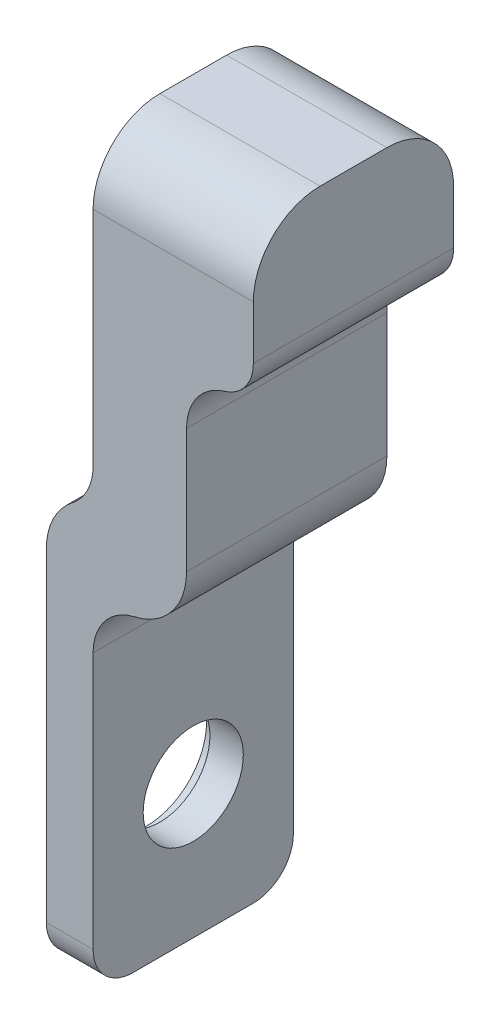
from build123d import *

# Parameters (mm, degrees)
BOSS_EXTRUDE1_DEPTH      = 12.5
BOSS_EXTRUDE1_DEPTH_BACK = 2.5
F_3DSKETCH2_R            = 4.5
CUT_EXTRUDE2_DEPTH       = 1
CUT_EXTRUDE3_REACH       = 68.802
SKETCH3_R                = 3.75
CUT_EXTRUDE6_OUTLINE_R   = 3.25
CUT_EXTRUDE6_DEPTH       = 10
CUT_EXTRUDE7_DEPTH       = 2.5
FILLET1_R                = 5
FILLET2_R                = 4
FILLET3_R                = 4
FILLET4_R                = 3
FILLET5_R                = 3
FILLET6_R                = 4


# Read off the part's stored shape, not the designer's step: Cut-Extrude6
with BuildPart() as part:
    # Sketch1 → Boss-Extrude1 (new, two sides: drawn at the far end of the back side and taken through both)
    with BuildSketch(Plane.XY.offset(-BOSS_EXTRUDE1_DEPTH_BACK)):
        Polygon((0, -8), (0, -32), (-3.5, -32), (-3.5, -64), (0, -64), (0, -38), (7, -38), (7, -20), (12, -20), (12, -8), align=None)
    extrude(amount=BOSS_EXTRUDE1_DEPTH + BOSS_EXTRUDE1_DEPTH_BACK)

    # 3DSketch2 → Cut-Extrude2 (cut)
    with BuildSketch(Plane(origin=(-3.5, -54, 5), x_dir=(0, -1, 0), z_dir=(-1, 0, 0))):
        with Locations(Location((0, 0, 0), (0, 0, 270))):
            Circle(F_3DSKETCH2_R)
    extrude(amount=-CUT_EXTRUDE2_DEPTH, mode=Mode.SUBTRACT)

    # Sketch3 → Cut-Extrude3 (cut, up to next)
    with BuildSketch(Plane.ZY.offset(2.5), mode=Mode.PRIVATE) as cut_extrude3_sk1:
        with Locations((5, -54)):
            Circle(SKETCH3_R)
    cut_extrude3_tool1 = extrude(cut_extrude3_sk1.sketch, amount=-CUT_EXTRUDE3_REACH, mode=Mode.PRIVATE) & part.part
    add(cut_extrude3_tool1.solids().sort_by_distance((-2.5, -54, 5))[0], mode=Mode.SUBTRACT)

    # Cut-Extrude6 outline → Cut-Extrude6 (cut)
    with BuildSketch(Plane.YZ):
        with Locations((-16.5, 5)):
            Circle(CUT_EXTRUDE6_OUTLINE_R)
    extrude(amount=CUT_EXTRUDE6_DEPTH, mode=Mode.SUBTRACT)

    # Sketch4 → Cut-Extrude7 (cut)
    with BuildSketch(Plane.ZY.offset(3.5)):
        with BuildLine():
            Line((5, -46.75), (5, -45.75))
            ThreePointArc((5, -45.75), (4.24685511, -45.784449332), (3.5, -45.88750963))
            Line((3.5, -45.88750963), (3.5, -46.75))
            Line((3.5, -46.75), (5, -46.75))
        make_face()
        with BuildLine():
            ThreePointArc((6.5, -45.88750963), (5.75314489, -45.784449332), (5, -45.75))
            Line((5, -45.75), (5, -46.75))
            Line((5, -46.75), (6.5, -46.75))
            Line((6.5, -46.75), (6.5, -45.88750963))
        make_face()
    extrude(amount=-CUT_EXTRUDE7_DEPTH, mode=Mode.SUBTRACT)

    # Fillet1
    # the kernel refuses this fillet: 5 mm, written as the material it takes off along each edge
    with BuildSketch(Plane(origin=(7, -38, -15), x_dir=(-1, 0, 0), z_dir=(0, 0, 1))) as fillet1_piece_1:
        with BuildLine():
            CenterArc((FILLET1_R, -FILLET1_R), FILLET1_R, 90, 90)
            Line((0, -FILLET1_R), (-FILLET1_R * 0.02, -FILLET1_R))
            Line((-FILLET1_R * 0.02, -FILLET1_R), (-FILLET1_R * 0.02, FILLET1_R * 0.02))
            Line((-FILLET1_R * 0.02, FILLET1_R * 0.02), (FILLET1_R, FILLET1_R * 0.02))
            Line((FILLET1_R, FILLET1_R * 0.02), (FILLET1_R, 0))
        make_face()
    extrude(amount=40, mode=Mode.SUBTRACT)
    with BuildSketch(Plane(origin=(24.5, -8, 12.5), x_dir=(0, 0, -1), z_dir=(-1, 0, 0))) as fillet1_piece_2:
        with BuildLine():
            CenterArc((FILLET1_R, FILLET1_R), FILLET1_R, 180, 90)
            Line((0, FILLET1_R), (-FILLET1_R * 0.02, FILLET1_R))
            Line((-FILLET1_R * 0.02, FILLET1_R), (-FILLET1_R * 0.02, -FILLET1_R * 0.02))
            Line((-FILLET1_R * 0.02, -FILLET1_R * 0.02), (FILLET1_R, -FILLET1_R * 0.02))
            Line((FILLET1_R, -FILLET1_R * 0.02), (FILLET1_R, 0))
        make_face()
    extrude(amount=37, mode=Mode.SUBTRACT)
    with BuildSketch(Plane(origin=(24.5, -8, -2.5), x_dir=(0, 0, 1), z_dir=(-1, 0, 0))) as fillet1_piece_3:
        with BuildLine():
            CenterArc((FILLET1_R, -FILLET1_R), FILLET1_R, 90, 90)
            Line((0, -FILLET1_R), (-FILLET1_R * 0.02, -FILLET1_R))
            Line((-FILLET1_R * 0.02, -FILLET1_R), (-FILLET1_R * 0.02, FILLET1_R * 0.02))
            Line((-FILLET1_R * 0.02, FILLET1_R * 0.02), (FILLET1_R, FILLET1_R * 0.02))
            Line((FILLET1_R, FILLET1_R * 0.02), (FILLET1_R, 0))
        make_face()
    extrude(amount=37, mode=Mode.SUBTRACT)
    with BuildSketch(Plane(origin=(-3.5, -32, -14.424240018), x_dir=(1, 0, 0), z_dir=(0, 0, 1))) as fillet1_piece_4:
        with BuildLine():
            CenterArc((5, -4.769696007), FILLET1_R, 107.457603124, 72.542396876)
            Line((0, -4.769696007), (-0.1, -4.769696007))
            Line((-0.1, -4.769696007), (-0.1, 0))
            Line((-0.1, 0), (0, 0.1))
            ThreePointArc((0, 0.1), (1.75, 0.1), (3.47, 0.09539392))
            Line((3.47, 0.09539392), (3.5, 0))
        make_face()
    extrude(amount=38.848480035, mode=Mode.SUBTRACT)

    # Fillet2
    fillet2_edges = [part.edges().sort_by_distance(p)[0] for p in [
        (0, -32, 5),
    ]]
    fillet(fillet2_edges, radius=FILLET2_R)

    # Fillet3
    fillet3_edges = [part.edges().sort_by_distance(p)[0] for p in [
        (0, -38, 5),
    ]]
    fillet(fillet3_edges, radius=FILLET3_R)

    # Fillet4
    fillet4_edges = [part.edges().sort_by_distance(p)[0] for p in [
        (-1.75, -64, 12.5),
        (-1.75, -64, -2.5),
    ]]
    fillet(fillet4_edges, radius=FILLET4_R)

    # Fillet5
    fillet5_edges = [part.edges().sort_by_distance(p)[0] for p in [
        (12, -20, 5),
    ]]
    fillet(fillet5_edges, radius=FILLET5_R)

    # Fillet6
    fillet6_edges = [part.edges().sort_by_distance(p)[0] for p in [
        (7, -20, 5),
    ]]
    fillet(fillet6_edges, radius=FILLET6_R)


solid = part.part
